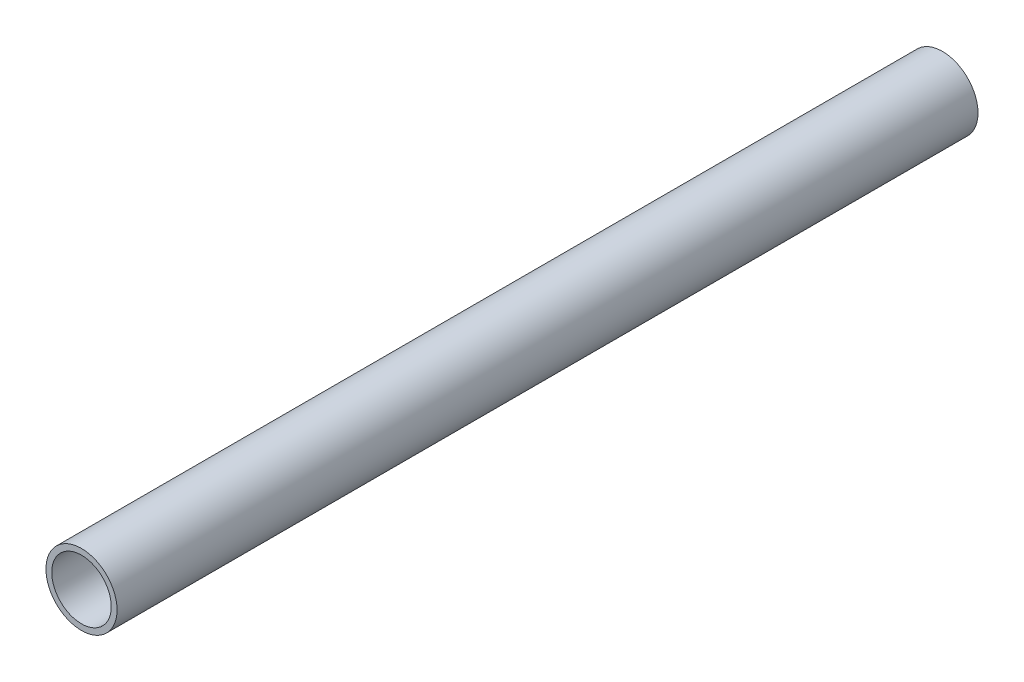
from build123d import *

# Parameters (mm, degrees)
SKETCH1_R           = 24.13
SKETCH1_R_2         = 20.193
BOSS_EXTRUDE1_DEPTH = 584.2


with BuildPart() as part:
    # Sketch1 → Boss-Extrude1 (new body)
    with BuildSketch(Plane.XY):
        Circle(SKETCH1_R)
        Circle(SKETCH1_R_2, mode=Mode.SUBTRACT)
    extrude(amount=BOSS_EXTRUDE1_DEPTH)


solid = part.part
